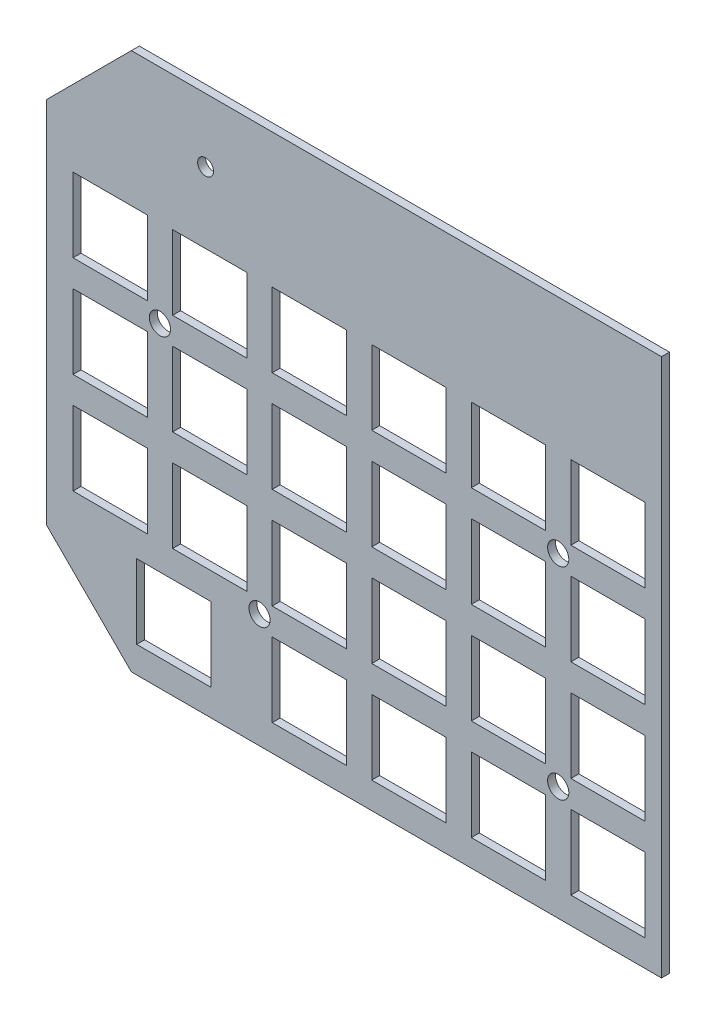
from build123d import *

# Parameters (mm, degrees)
BOSS_EXTRU_1_DEPTH      = 1.5
ESQUISSE2_R             = 2
ESQUISSE2_R_2           = 1.5
ESQUISSE2_W             = 14
ESQUISSE2_H             = 14
ENL_V_MAT_EXTRU_1_DEPTH = 1.5


with BuildPart() as part:
    # Esquisse1 → Boss.-Extru.1 (new body)
    with BuildSketch(Plane.XY):
        Polygon((0, -85), (16, -101), (116, -101), (116, 0.5), (16, 0.5), (0, -15.5), align=None)
    extrude(amount=BOSS_EXTRU_1_DEPTH)

    # Esquisse2 → Enlèv. mat.-Extru.1 (cut)
    with BuildSketch(Plane.XY.offset(1.5)):
        with Locations((21.390641344, -41.375)):
            Circle(ESQUISSE2_R)
        with Locations((96.5157721, -41.375)):
            Circle(ESQUISSE2_R)
        with Locations((96.5157721, -79.475)):
            Circle(ESQUISSE2_R)
        with Locations((40.171924033, -79.475)):
            Circle(ESQUISSE2_R)
        with Locations((30, -11.5)):
            Circle(ESQUISSE2_R_2)
        with Locations((12, -31.85)):
            Rectangle(ESQUISSE2_W, ESQUISSE2_H)
        with Locations((30.781282689, -31.85)):
            Rectangle(ESQUISSE2_W, ESQUISSE2_H)
        with Locations((49.562565378, -31.85)):
            Rectangle(ESQUISSE2_W, ESQUISSE2_H)
        with Locations((68.343848066, -31.85)):
            Rectangle(ESQUISSE2_W, ESQUISSE2_H)
        with Locations((87.125130755, -31.85)):
            Rectangle(ESQUISSE2_W, ESQUISSE2_H)
        with Locations((105.906413444, -31.85)):
            Rectangle(ESQUISSE2_W, ESQUISSE2_H)
        with Locations((30.781282689, -50.9)):
            Rectangle(ESQUISSE2_W, ESQUISSE2_H)
        with Locations((49.562565378, -50.9)):
            Rectangle(ESQUISSE2_W, ESQUISSE2_H)
        with Locations((68.343848066, -50.9)):
            Rectangle(ESQUISSE2_W, ESQUISSE2_H)
        with Locations((87.125130755, -50.9)):
            Rectangle(ESQUISSE2_W, ESQUISSE2_H)
        with Locations((105.906413444, -50.9)):
            Rectangle(ESQUISSE2_W, ESQUISSE2_H)
        with Locations((30.781282689, -69.95)):
            Rectangle(ESQUISSE2_W, ESQUISSE2_H)
        with Locations((49.562565378, -69.95)):
            Rectangle(ESQUISSE2_W, ESQUISSE2_H)
        with Locations((68.343848066, -69.95)):
            Rectangle(ESQUISSE2_W, ESQUISSE2_H)
        with Locations((87.125130755, -69.95)):
            Rectangle(ESQUISSE2_W, ESQUISSE2_H)
        with Locations((105.906413444, -69.95)):
            Rectangle(ESQUISSE2_W, ESQUISSE2_H)
        with Locations((12, -50.9)):
            Rectangle(ESQUISSE2_W, ESQUISSE2_H)
        with Locations((12, -69.95)):
            Rectangle(ESQUISSE2_W, ESQUISSE2_H)
        with Locations((49.562565378, -89)):
            Rectangle(ESQUISSE2_W, ESQUISSE2_H)
        with Locations((68.343848066, -89)):
            Rectangle(ESQUISSE2_W, ESQUISSE2_H)
        with Locations((87.125130755, -89)):
            Rectangle(ESQUISSE2_W, ESQUISSE2_H)
        with Locations((105.906413444, -89)):
            Rectangle(ESQUISSE2_W, ESQUISSE2_H)
        with Locations((24, -89)):
            Rectangle(ESQUISSE2_W, ESQUISSE2_H)
    extrude(amount=-ENL_V_MAT_EXTRU_1_DEPTH, mode=Mode.SUBTRACT)


solid = part.part
